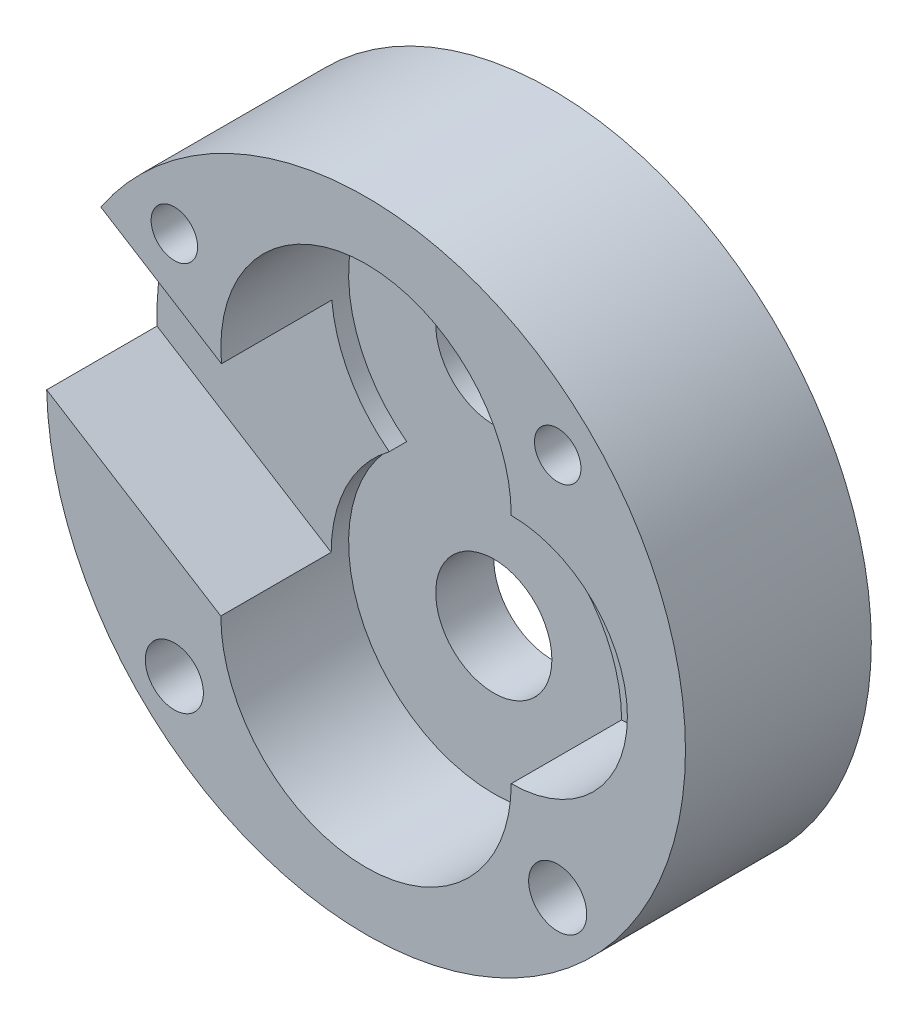
from build123d import *

# Parameters (mm, degrees)
SKETCH1_R           = 55
BOSS_EXTRUDE1_DEPTH = 32
CUT_EXTRUDE1_DEPTH  = 22
CUT_EXTRUDE2_DEPTH  = 19
SKETCH1_21_R        = 10
SKETCH1_21_R_2      = 4
SKETCH1_21_R_3      = 5
CUT_EXTRUDE3_DEPTH  = 85.107074613


with BuildPart() as part:
    # Sketch1 → Boss-Extrude1 (new body)
    with BuildSketch(Plane.XY):
        Circle(SKETCH1_R)
    extrude(amount=-BOSS_EXTRUDE1_DEPTH)

    # Sketch1<19> → Cut-Extrude1 (cut)
    with BuildSketch(Plane.XY):
        with BuildLine():
            ThreePointArc((-15, 0), (0, -45), (15, 0))
            ThreePointArc((15, 0), (0, 45), (-15, 0))
        make_face()
    extrude(amount=-CUT_EXTRUDE1_DEPTH, mode=Mode.SUBTRACT)

    # Sketch1<20> → Cut-Extrude2 (cut)
    with BuildSketch(Plane.XY):
        with BuildLine():
            ThreePointArc((-45.668792135, 30.649003654), (-52.795976975, 15.41378653), (-54.985496966, -1.262981944))
            Line((-54.985496966, -1.262981944), (-25, -20))
            ThreePointArc((-25, -20), (-22.360679775, -8.819660113), (-15, 0))
            ThreePointArc((-15, 0), (-21.813646246, 7.786694246), (-24.890758601, 17.665447305))
            Line((-24.890758601, 17.665447305), (-45.668792135, 30.649003654))
        make_face()
        with BuildLine():
            ThreePointArc((15, 0), (22.360679775, -8.819660113), (25, -20))
            ThreePointArc((25, -20), (45, 0), (25, 20))
            ThreePointArc((25, 20), (22.360679775, 8.819660113), (15, 0))
        make_face()
    extrude(amount=-CUT_EXTRUDE2_DEPTH, mode=Mode.SUBTRACT)

    # Sketch1<21> → Cut-Extrude3 (cut, through all)
    with BuildSketch(Plane.XY):
        with Locations((0, 20)):
            Circle(SKETCH1_21_R)
        with Locations((0, -20)):
            Circle(SKETCH1_21_R)
        with Locations((-33, 33)):
            Circle(SKETCH1_21_R_2)
        with Locations((33, 33)):
            Circle(SKETCH1_21_R_2)
        with Locations((33, -33)):
            Circle(SKETCH1_21_R_3)
        with Locations((-33, -33)):
            Circle(SKETCH1_21_R_3)
    extrude(amount=-CUT_EXTRUDE3_DEPTH, mode=Mode.SUBTRACT)


solid = part.part
